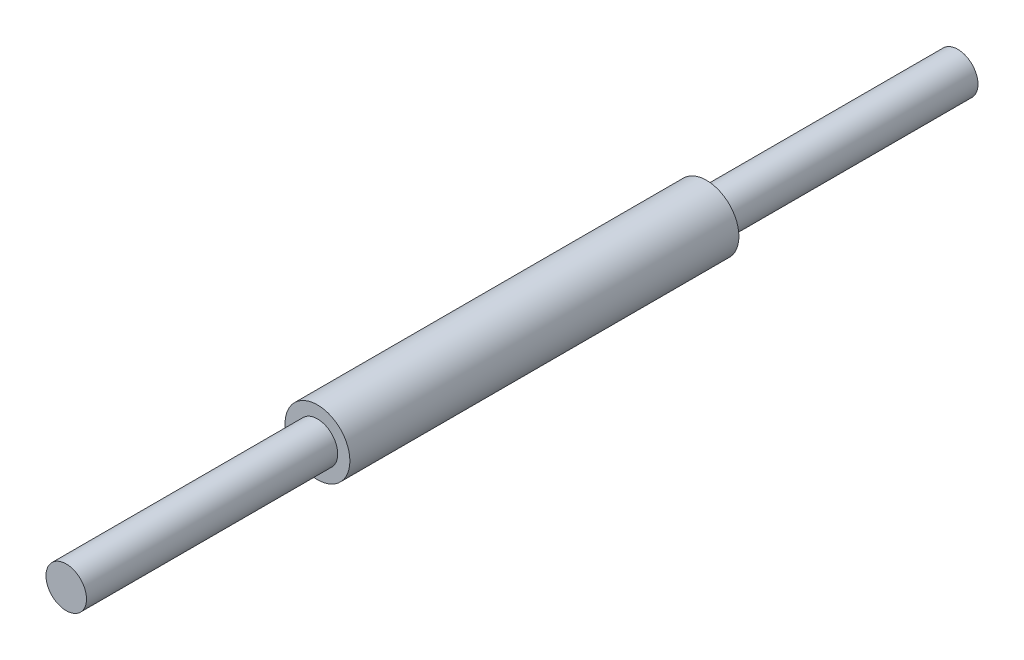
from build123d import *

# Parameters (mm, degrees)
BOSS_EXTRUDE1_DEPTH      = 69.85
BOSS_EXTRUDE1_DEPTH_BACK = 69.85
SKETCH2_R                = 3.175
BOSS_EXTRUDE2_DEPTH      = 30.48
BOSS_EXTRUDE2_DEPTH_BACK = 30.48
SKETCH3_R                = 5.08


with BuildPart() as part:
    # Sketch2 → Boss-Extrude1 (new, two sides: drawn at the far end of the back side and taken through both)
    with BuildSketch(Plane.XY.offset(-BOSS_EXTRUDE1_DEPTH_BACK)):
        Circle(SKETCH2_R)
    extrude(amount=BOSS_EXTRUDE1_DEPTH + BOSS_EXTRUDE1_DEPTH_BACK)

    # Sketch3 → Boss-Extrude2 (add, two sides: drawn at the far end of the back side and taken through both)
    with BuildSketch(Plane.XY.offset(-BOSS_EXTRUDE2_DEPTH_BACK)):
        Circle(SKETCH3_R)
    extrude(amount=BOSS_EXTRUDE2_DEPTH + BOSS_EXTRUDE2_DEPTH_BACK)


solid = part.part
